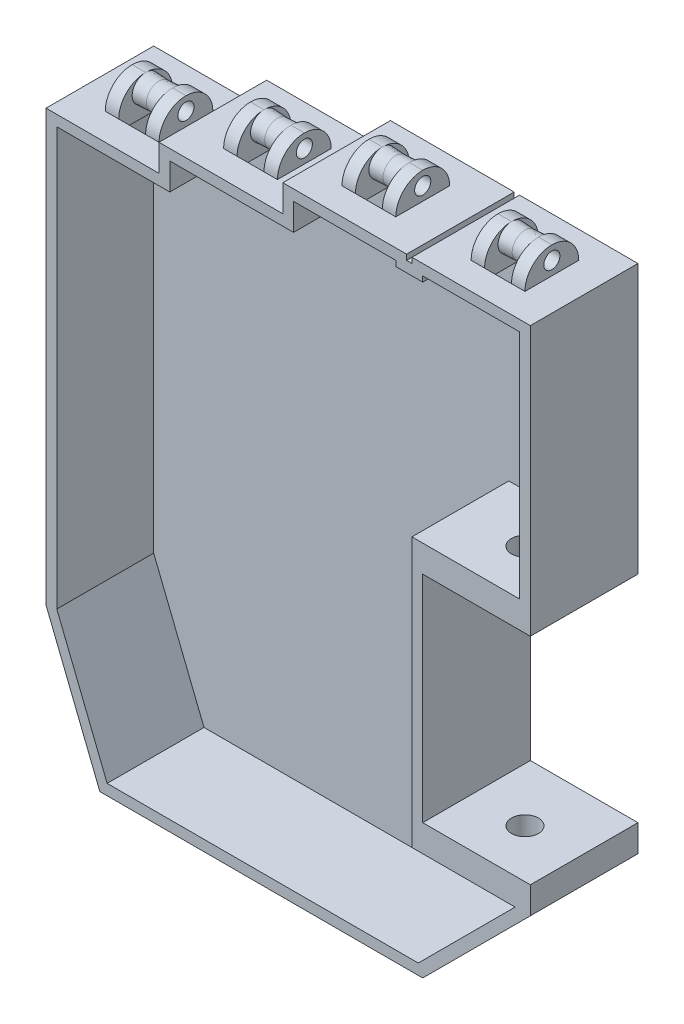
from build123d import *

# Parameters (mm, degrees)
BOSS_EXTRUDE1_DEPTH       = 20
SKETCH2_W                 = 20
SKETCH2_H                 = 40
CUT_EXTRUDE1_DEPTH        = 142.509716981
SHELL1_T                  = -2
SHELL1_THICKNESS_2_FACE_W = 20
SHELL1_THICKNESS_2_FACE_H = 18
SHELL1_THICKNESS_2_DEPTH  = 3
SHELL1_THICKNESS_3_FACE_W = 18
SHELL1_THICKNESS_3_FACE_H = 20
SHELL1_THICKNESS_3_DEPTH  = 3
CUT_EXTRUDE14_REACH       = 110.167
SKETCH34_R                = 2.5
SKETCH3_W                 = 2.5
SKETCH3_H                 = 10
BOSS_EXTRUDE2_DEPTH       = 5
FILLET2_R                 = 5
CUT_EXTRUDE3_REACH        = 149.838
SKETCH6_R                 = 1.5
SKETCH21_R                = 2.5
SKETCH21_R_2              = 1.5
BOSS_EXTRUDE10_DEPTH      = 2.5
BOSS_EXTRUDE10_DRAFT      = 3
MIRROR7_COPY_1_SKETCH_R   = 2.5
MIRROR7_COPY_1_SKETCH_R_2 = 1.5
MIRROR7_COPY_1_DEPTH      = 2.5
MIRROR7_COPY_1_DRAFT      = 3
SKETCH26_W                = 5
SKETCH26_H                = 10
CUT_EXTRUDE8_DEPTH        = 2
SKETCH7_W                 = 2.5
SKETCH7_H                 = 10
BOSS_EXTRUDE4_DEPTH       = 5
FILLET4_R                 = 5
SKETCH22_R                = 2.5
BOSS_EXTRUDE11_DEPTH      = 2.5
BOSS_EXTRUDE11_TAPER      = 3
SKETCH23_R                = 1.5
CUT_EXTRUDE7_DEPTH        = 10
SKETCH27_W                = 5
SKETCH27_H                = 10
CUT_EXTRUDE9_DEPTH        = 2
SKETCH10_W                = 2.5
SKETCH10_H                = 10
BOSS_EXTRUDE6_DEPTH       = 5
FILLET6_R                 = 5
SKETCH28_R                = 2.5
BOSS_EXTRUDE12_DEPTH      = 2.5
BOSS_EXTRUDE12_TAPER      = 3
SKETCH29_R                = 1.5
CUT_EXTRUDE10_DEPTH       = 10
SKETCH30_W                = 5
SKETCH30_H                = 10
CUT_EXTRUDE11_DEPTH       = 2
SKETCH13_W                = 2.5
SKETCH13_H                = 10
BOSS_EXTRUDE8_DEPTH       = 5
FILLET8_R                 = 5
SKETCH31_R                = 2.5
BOSS_EXTRUDE13_DEPTH      = 2.5
BOSS_EXTRUDE13_TAPER      = 3
SKETCH32_R                = 1.5
CUT_EXTRUDE12_DEPTH       = 10
SKETCH33_W                = 5
SKETCH33_H                = 10
CUT_EXTRUDE13_DEPTH       = 2


with BuildPart() as part:
    # Sketch1 → Boss-Extrude1 (new body)
    with BuildSketch(Plane.XY):
        Polygon((58, 114), (58, 115), (80, 115), (80, 20), (60, 0), (0, 0), (-10, 25), (-10, 105), (11, 105), (11, 110), (12, 110), (34, 110), (34, 115), (35, 115), (57, 115), (57, 114), align=None)
    extrude(amount=BOSS_EXTRUDE1_DEPTH)

    # Sketch2 → Cut-Extrude1 (cut, through all)
    with BuildSketch(Plane.XY.offset(20)):
        with Locations((70, 45)):
            Rectangle(SKETCH2_W, SKETCH2_H)
    extrude(amount=-CUT_EXTRUDE1_DEPTH, mode=Mode.SUBTRACT)

    # Shell1
    shell1_openings = [part.faces().sort_by_distance(p)[0] for p in [
        (32.550473836, 58.500730419, 20),
    ]]
    offset(amount=SHELL1_T, openings=shell1_openings, kind=Kind.INTERSECTION)

    # Shell1 thickness 2 face (on inner face of the shell) → Shell1 thickness 2 (add)
    with BuildSketch(Plane(origin=(68, 23, 11), x_dir=(1, 0, 0), z_dir=(0, 1, 0))):
        Rectangle(SHELL1_THICKNESS_2_FACE_W, SHELL1_THICKNESS_2_FACE_H)
    extrude(amount=-SHELL1_THICKNESS_2_DEPTH)

    # Shell1 thickness 3 face (on inner face of the shell) → Shell1 thickness 3 (add)
    with BuildSketch(Plane(origin=(68, 67, 11), x_dir=(0, 0, -1), z_dir=(0, -1, 0))):
        Rectangle(SHELL1_THICKNESS_3_FACE_W, SHELL1_THICKNESS_3_FACE_H)
    extrude(amount=-SHELL1_THICKNESS_3_DEPTH)

    # Cut-Extrude14: up to this face of the body (flat: up to its plane)
    cut_extrude14_end = Plane(part.part.faces().sort_by_distance((67.585786438, 20, 11))[0])
    # Sketch34 → Cut-Extrude14 (cut, up to the picked face)
    with BuildSketch(Plane(origin=(0, 70, 0), x_dir=(1, 0, 0), z_dir=(0, 1, 0)), mode=Mode.PRIVATE) as cut_extrude14_sk1:
        with Locations(Location((70, -11, 0), (0, 0, 270))):
            Circle(SKETCH34_R)
    cut_extrude14_tool1 = split(extrude(cut_extrude14_sk1.sketch, amount=-CUT_EXTRUDE14_REACH, mode=Mode.PRIVATE), bisect_by=cut_extrude14_end, keep=Keep.BOTH, mode=Mode.PRIVATE)
    add(cut_extrude14_tool1.solids().sort_by(Axis((70, 70, 11), (0, -1, 0)))[0], mode=Mode.SUBTRACT)

    # Sketch3 → Boss-Extrude2 (add)
    with BuildSketch(Plane(origin=(0, 115, 0), x_dir=(1, 0, 0), z_dir=(0, 1, 0))):
        with Locations((65.25, -10)):
            Rectangle(SKETCH3_W, SKETCH3_H)
        with Locations((72.75, -10)):
            Rectangle(SKETCH3_W, SKETCH3_H)
    extrude(amount=BOSS_EXTRUDE2_DEPTH)

    # Fillet2
    fillet2_edges = [part.edges().sort_by_distance(p)[0] for p in [
        (65.25, 120, 5),
        (65.25, 120, 15),
        (72.75, 120, 5),
        (72.75, 120, 15),
    ]]
    fillet(fillet2_edges, radius=FILLET2_R - 0.0001)  # a hair under: the kernel refuses the full size

    # Cut-Extrude3: up to this face of the body (flat: up to its plane)
    cut_extrude3_end = Plane(part.part.faces().sort_by_distance((64, 117.122079053, 10))[0])
    # Sketch6 → Cut-Extrude3 (cut, up to the picked face)
    with BuildSketch(Plane(origin=(74, 0, 0), x_dir=(0, 0, -1), z_dir=(1, 0, 0)), mode=Mode.PRIVATE) as cut_extrude3_sk1:
        with Locations((-10, 117.5)):
            Circle(SKETCH6_R)
    cut_extrude3_tool1 = split(extrude(cut_extrude3_sk1.sketch, amount=-CUT_EXTRUDE3_REACH, mode=Mode.PRIVATE), bisect_by=cut_extrude3_end, keep=Keep.BOTH, mode=Mode.PRIVATE)
    add(cut_extrude3_tool1.solids().sort_by(Axis((74, 117.5, 10), (-1, 0, 0)))[0], mode=Mode.SUBTRACT)


with BuildPart() as boss_extrude10_tool:
    # Sketch21 → Boss-Extrude10 (with draft: the straight prism first)
    with BuildSketch(Plane(origin=(66.5, 0, 0), x_dir=(0, 0, -1), z_dir=(1, 0, 0))):
        with Locations((-10, 117.5)):
            Circle(SKETCH21_R)
        with Locations((-10, 117.5)):
            Circle(SKETCH21_R_2, mode=Mode.SUBTRACT)
    extrude(amount=BOSS_EXTRUDE10_DEPTH)
    # Boss-Extrude10: the draft: its side faces are tilted about the plane it starts from
    boss_extrude10_sides = [boss_extrude10_tool.faces().sort_by_distance(p)[0] for p in [
        (67.75, 117.5, 12.5),
        (67.75, 117.5, 11.5),
    ]]
    draft(boss_extrude10_sides, Plane(origin=(66.5, 0, 0), x_dir=(0, 0, -1), z_dir=(1, 0, 0)), BOSS_EXTRUDE10_DRAFT)


with BuildPart() as part_1:
    add(part.part)

    # Boss-Extrude10: add boss_extrude10_tool
    add(boss_extrude10_tool.part)


with BuildPart() as mirror7_copy_1_tool:
    # Mirror7 copy 1 sketch → Mirror7 copy 1 (with draft: the straight prism first)
    with BuildSketch(Plane(origin=(71.5, 0, 0), x_dir=(0, 0, -1), z_dir=(-1, 0, 0))):
        with Locations((-10, -117.5)):
            Circle(MIRROR7_COPY_1_SKETCH_R)
        with Locations((-10, -117.5)):
            Circle(MIRROR7_COPY_1_SKETCH_R_2, mode=Mode.SUBTRACT)
    extrude(amount=MIRROR7_COPY_1_DEPTH)
    # Mirror7 copy 1: the draft: its side faces are tilted about the plane it starts from
    mirror7_copy_1_sides = [mirror7_copy_1_tool.faces().sort_by_distance(p)[0] for p in [
        (70.25, 117.5, 12.5),
        (70.25, 117.5, 11.5),
    ]]
    draft(mirror7_copy_1_sides, Plane(origin=(71.5, 0, 0), x_dir=(0, 0, -1), z_dir=(-1, 0, 0)), MIRROR7_COPY_1_DRAFT)


with BuildPart() as part_2:
    add(part_1.part)

    # Mirror7 copy 1: add mirror7_copy_1_tool
    add(mirror7_copy_1_tool.part)

    # Sketch26 → Cut-Extrude8 (cut)
    with BuildSketch(Plane(origin=(0, 115, 0), x_dir=(1, 0, 0), z_dir=(0, 1, 0))):
        with Locations((69, -10)):
            Rectangle(SKETCH26_W, SKETCH26_H)
    extrude(amount=-CUT_EXTRUDE8_DEPTH, mode=Mode.SUBTRACT)

    # Sketch7 → Boss-Extrude4 (add)
    with BuildSketch(Plane(origin=(0, 115, 0), x_dir=(1, 0, 0), z_dir=(0, 1, 0))):
        with Locations((41.25, -10)):
            Rectangle(SKETCH7_W, SKETCH7_H)
        with Locations((48.75, -10)):
            Rectangle(SKETCH7_W, SKETCH7_H)
    extrude(amount=BOSS_EXTRUDE4_DEPTH)

    # Fillet4
    fillet4_edges = [part_2.edges().sort_by_distance(p)[0] for p in [
        (41.25, 120, 5),
        (41.25, 120, 15),
        (48.75, 120, 5),
        (48.75, 120, 15),
    ]]
    fillet(fillet4_edges, radius=FILLET4_R - 0.0001)  # a hair under: the kernel refuses the full size

    # Sketch22 → Boss-Extrude11 (add)
    with BuildSketch(Plane(origin=(42.5, 0, 0), x_dir=(0, 0, -1), z_dir=(1, 0, 0))):
        with Locations((-10, 117.5)):
            Circle(SKETCH22_R)
    boss_extrude11 = extrude(amount=BOSS_EXTRUDE11_DEPTH, taper=BOSS_EXTRUDE11_TAPER)

    # Mirror8: Boss-Extrude11 across plane
    add(boss_extrude11.mirror(Plane(origin=(45, 117.5, 10), x_dir=(0, 0, 1), z_dir=(1, 0, 0))))

    # Sketch23 → Cut-Extrude7 (cut)
    with BuildSketch(Plane(origin=(50, 0, 0), x_dir=(0, 0, -1), z_dir=(1, 0, 0))):
        with Locations((-10, 117.5)):
            Circle(SKETCH23_R)
    extrude(amount=-CUT_EXTRUDE7_DEPTH, mode=Mode.SUBTRACT)

    # Sketch27 → Cut-Extrude9 (cut)
    with BuildSketch(Plane(origin=(0, 115, 0), x_dir=(1, 0, 0), z_dir=(0, 1, 0))):
        with Locations((45, -10)):
            Rectangle(SKETCH27_W, SKETCH27_H)
    extrude(amount=-CUT_EXTRUDE9_DEPTH, mode=Mode.SUBTRACT)

    # Sketch10 → Boss-Extrude6 (add)
    with BuildSketch(Plane(origin=(0, 110, 0), x_dir=(1, 0, 0), z_dir=(0, 1, 0))):
        with Locations((19.25, -10)):
            Rectangle(SKETCH10_W, SKETCH10_H)
        with Locations((26.75, -10)):
            Rectangle(SKETCH10_W, SKETCH10_H)
    extrude(amount=BOSS_EXTRUDE6_DEPTH)

    # Fillet6
    fillet6_edges = [part_2.edges().sort_by_distance(p)[0] for p in [
        (19.25, 115, 15),
        (19.25, 115, 5),
        (26.75, 115, 5),
        (26.75, 115, 15),
    ]]
    fillet(fillet6_edges, radius=FILLET6_R - 0.0001)  # a hair under: the kernel refuses the full size

    # Sketch28 → Boss-Extrude12 (add)
    with BuildSketch(Plane(origin=(20.5, 0, 0), x_dir=(0, 0, -1), z_dir=(1, 0, 0))):
        with Locations((-10, 112.5)):
            Circle(SKETCH28_R)
    boss_extrude12 = extrude(amount=BOSS_EXTRUDE12_DEPTH, taper=BOSS_EXTRUDE12_TAPER)

    # Mirror9: Boss-Extrude12 across plane
    add(boss_extrude12.mirror(Plane(origin=(23, 112.5, 10), x_dir=(0, 0, 1), z_dir=(1, 0, 0))))

    # Sketch29 → Cut-Extrude10 (cut)
    with BuildSketch(Plane(origin=(28, 0, 0), x_dir=(0, 0, -1), z_dir=(1, 0, 0))):
        with Locations((-10, 112.5)):
            Circle(SKETCH29_R)
    extrude(amount=-CUT_EXTRUDE10_DEPTH, mode=Mode.SUBTRACT)

    # Sketch30 → Cut-Extrude11 (cut)
    with BuildSketch(Plane(origin=(0, 110, 0), x_dir=(1, 0, 0), z_dir=(0, 1, 0))):
        with Locations((23, -10)):
            Rectangle(SKETCH30_W, SKETCH30_H)
    extrude(amount=-CUT_EXTRUDE11_DEPTH, mode=Mode.SUBTRACT)

    # Sketch13 → Boss-Extrude8 (add)
    with BuildSketch(Plane(origin=(0, 105, 0), x_dir=(1, 0, 0), z_dir=(0, 1, 0))):
        with Locations((-2.75, -10)):
            Rectangle(SKETCH13_W, SKETCH13_H)
        with Locations((4.75, -10)):
            Rectangle(SKETCH13_W, SKETCH13_H)
    extrude(amount=BOSS_EXTRUDE8_DEPTH)

    # Fillet8
    fillet8_edges = [part_2.edges().sort_by_distance(p)[0] for p in [
        (-2.75, 110, 15),
        (-2.75, 110, 5),
        (4.75, 110, 5),
        (4.75, 110, 15),
    ]]
    fillet(fillet8_edges, radius=FILLET8_R - 0.0001)  # a hair under: the kernel refuses the full size

    # Sketch31 → Boss-Extrude13 (add)
    with BuildSketch(Plane(origin=(-1.5, 0, 0), x_dir=(0, 0, -1), z_dir=(1, 0, 0))):
        with Locations((-10, 107.5)):
            Circle(SKETCH31_R)
    boss_extrude13 = extrude(amount=BOSS_EXTRUDE13_DEPTH, taper=BOSS_EXTRUDE13_TAPER)

    # Mirror10: Boss-Extrude13 across plane
    add(boss_extrude13.mirror(Plane(origin=(1, 107.5, 10), x_dir=(0, 0, 1), z_dir=(1, 0, 0))))

    # Sketch32 → Cut-Extrude12 (cut)
    with BuildSketch(Plane(origin=(6, 0, 0), x_dir=(0, 0, -1), z_dir=(1, 0, 0))):
        with Locations((-10, 107.5)):
            Circle(SKETCH32_R)
    extrude(amount=-CUT_EXTRUDE12_DEPTH, mode=Mode.SUBTRACT)

    # Sketch33 → Cut-Extrude13 (cut)
    with BuildSketch(Plane(origin=(0, 105, 0), x_dir=(1, 0, 0), z_dir=(0, 1, 0))):
        with Locations((1, -10)):
            Rectangle(SKETCH33_W, SKETCH33_H)
    extrude(amount=-CUT_EXTRUDE13_DEPTH, mode=Mode.SUBTRACT)


solid = part_2.part
